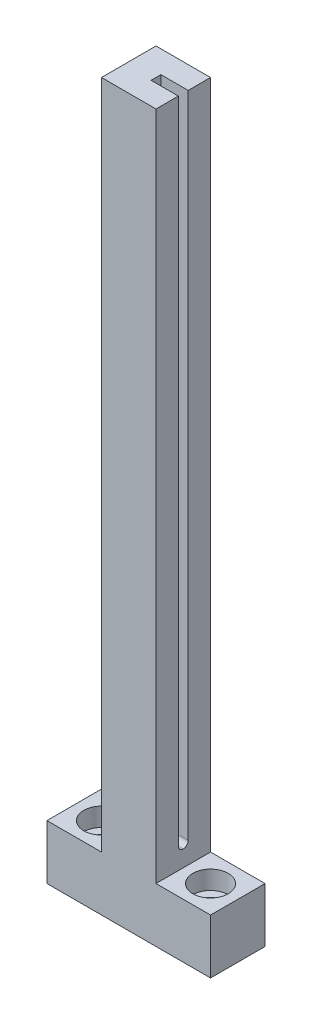
from build123d import *

# Parameters (mm, degrees)
SKETCH1_W                                           = 10
SKETCH1_H                                           = 10
BOSS_EXTRUDE1_DEPTH                                 = 133
SKETCH3_W                                           = 1.8
SKETCH3_H                                           = 120
CUT_EXTRUDE1_DEPTH                                  = 5
FILLET1_R                                           = 0.9
SKETCH4_W                                           = 10
SKETCH4_H                                           = 10
BOSS_EXTRUDE3_DEPTH                                 = 15
CBORE_FOR_M3_HEX_SOCKET_HEAD_CAP_SCREW1_D           = 3.4
CBORE_FOR_M3_HEX_SOCKET_HEAD_CAP_SCREW1_CBORE_D     = 6.5
CBORE_FOR_M3_HEX_SOCKET_HEAD_CAP_SCREW1_CBORE_DEPTH = 3.4
F_1_0MM_DOWEL_HOLE1_D                               = 1
F_1_0MM_DOWEL_HOLE1_DEPTH                           = 8
F_1_0MM_DOWEL_HOLE1_TIP                             = 0.30043031


with BuildPart() as part:
    # Sketch1 → Boss-Extrude1 (new body)
    with BuildSketch(Plane(origin=(0, 0, 0), x_dir=(1, 0, 0), z_dir=(0, 1, 0))):
        Rectangle(SKETCH1_W, SKETCH1_H)
    extrude(amount=BOSS_EXTRUDE1_DEPTH)

    # Sketch3 → Cut-Extrude1 (cut)
    with BuildSketch(Plane(origin=(5, 0, 0), x_dir=(0, 0, -1), z_dir=(1, 0, 0))):
        with Locations((0, 73)):
            Rectangle(SKETCH3_W, SKETCH3_H)
    extrude(amount=-CUT_EXTRUDE1_DEPTH, mode=Mode.SUBTRACT)

    # Fillet1
    fillet1_edges = [part.edges().sort_by_distance(p)[0] for p in [
        (2.5, 13, 0.9),
        (2.5, 13, -0.9),
    ]]
    fillet(fillet1_edges, radius=FILLET1_R - 0.0001)  # a hair under: the kernel refuses the full size

    # Sketch4 → Boss-Extrude3 (add, symmetric)
    with BuildSketch(Plane(origin=(0, 0, 0), x_dir=(0, 0, -1), z_dir=(1, 0, 0))):
        with Locations((0, 5)):
            Rectangle(SKETCH4_W, SKETCH4_H)
    extrude(amount=BOSS_EXTRUDE3_DEPTH, both=True)

    # CBORE for M3 Hex Socket Head Cap Screw1 (through all)
    with Locations(Plane(origin=(10, 10, 0), x_dir=(0, 0, 1), z_dir=(0, 1, 0))):
        with Locations((0, 0)):
            cbore_for_m3_hex_socket_head_cap_screw1 = CounterBoreHole(CBORE_FOR_M3_HEX_SOCKET_HEAD_CAP_SCREW1_D / 2, CBORE_FOR_M3_HEX_SOCKET_HEAD_CAP_SCREW1_CBORE_D / 2, CBORE_FOR_M3_HEX_SOCKET_HEAD_CAP_SCREW1_CBORE_DEPTH)

    # Mirror1: CBORE for M3 Hex Socket Head Cap Screw1 across plane
    add(cbore_for_m3_hex_socket_head_cap_screw1.mirror(Plane(origin=(0, 0, 0), x_dir=(0, 0, 1), z_dir=(1, 0, 0))), mode=Mode.SUBTRACT)

    # Ø1.0mm Dowel Hole1
    with Locations(Plane(origin=(0, 0, 0), x_dir=(0, 0, -1), z_dir=(0, -1, 0))):
        with Locations((0, 0)):
            Hole(F_1_0MM_DOWEL_HOLE1_D / 2, depth=F_1_0MM_DOWEL_HOLE1_DEPTH)
            with Locations((0, 0, -(F_1_0MM_DOWEL_HOLE1_DEPTH + F_1_0MM_DOWEL_HOLE1_TIP / 2))):  # 118° drill point
                Cone(0, F_1_0MM_DOWEL_HOLE1_D / 2, F_1_0MM_DOWEL_HOLE1_TIP, mode=Mode.SUBTRACT)


solid = part.part
